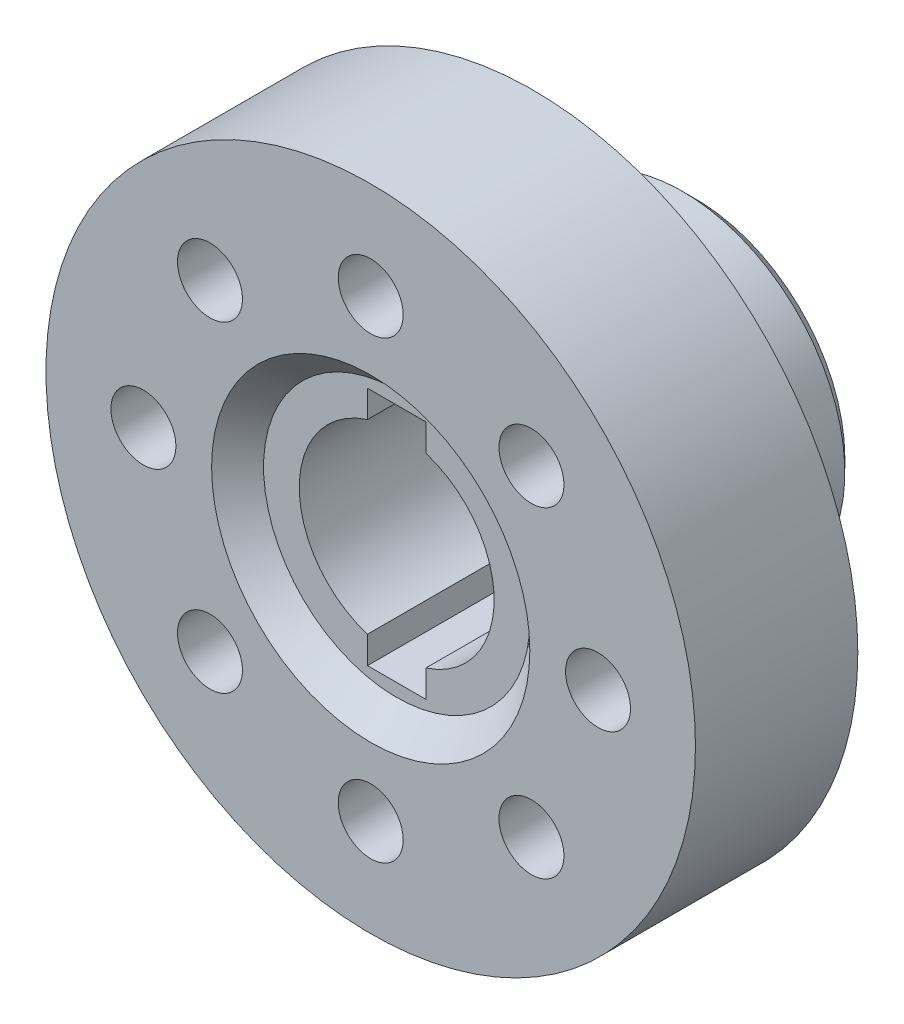
from build123d import *

# Parameters (mm, degrees)
SKETCH1_R                                = 50
BOSS_EXTRUDE1_DEPTH                      = 25
CBORE_FOR_M10_HEX_HEAD_BOLT1_D           = 10
CBORE_FOR_M10_HEX_HEAD_BOLT1_CBORE_D     = 20
CBORE_FOR_M10_HEX_HEAD_BOLT1_CBORE_DEPTH = 12.5
SKETCH5_R                                = 25
BOSS_EXTRUDE2_DEPTH                      = 25
CHAMFER1_SIZE                            = 2
CUT_EXTRUDE1_DEPTH                       = 87.602540436
SKETCH9_R                                = 24.5
CUT_EXTRUDE2_DEPTH                       = 4
CHAMFER2_SIZE                            = 4
CHAMFER3_SIZE                            = 2


# Some blends are built 0.0001 mm under size
with BuildPart() as part:
    # Sketch1 → Boss-Extrude1 (new body)
    with BuildSketch(Plane.XY):
        Circle(SKETCH1_R)
    extrude(amount=-BOSS_EXTRUDE1_DEPTH)

    # CBORE for M10 Hex Head Bolt1 (through all)
    with Locations(Plane(origin=(0, 0, -25), x_dir=(-1, 0, 0), z_dir=(0, 0, -1))):
        with Locations((-24.748737342, 24.748737342), (0, 35), (24.748737342, 24.748737342), (35, 0), (24.748737342, -24.748737342), (0, -35), (-24.748737342, -24.748737342), (-35, 0)):
            CounterBoreHole(CBORE_FOR_M10_HEX_HEAD_BOLT1_D / 2, CBORE_FOR_M10_HEX_HEAD_BOLT1_CBORE_D / 2, CBORE_FOR_M10_HEX_HEAD_BOLT1_CBORE_DEPTH)

    # Sketch5 → Boss-Extrude2 (add)
    with BuildSketch(Plane(origin=(0, 0, -25), x_dir=(-1, 0, 0), z_dir=(0, 0, -1))):
        with Locations(Location((0, 0, 0), (0, 0, 180))):
            Circle(SKETCH5_R)
    extrude(amount=BOSS_EXTRUDE2_DEPTH)

    # Chamfer1
    # the kernel refuses this chamfer: 2 mm, written as the material it takes off along each edge
    with BuildSketch(Plane(origin=(24.748737342, 24.748737342, -25), x_dir=(-1, 0, 0), z_dir=(0, -1, 0))) as chamfer1_piece_1_section:
        Polygon((10 + CHAMFER1_SIZE, 0), (10, -CHAMFER1_SIZE), (10, 0), align=None)
    chamfer1_piece_1 = revolve(axis=Axis((24.748737342, 24.748737342, -25), (0, 0, -1)), revolution_arc=315.000000416, mode=Mode.PRIVATE)
    chamfer1_piece_1 = chamfer1_piece_1 - Plane(origin=(0, 0, -24.034020629), x_dir=(1, 0, 0), z_dir=(0, 0, 1)) * Cylinder(25, 48, mode=Mode.PRIVATE)
    add(chamfer1_piece_1, mode=Mode.SUBTRACT)
    with BuildSketch(Plane(origin=(35, 0, -25), x_dir=(-1, 0, 0), z_dir=(0, -1, 0))) as chamfer1_piece_2_section:
        Polygon((10 + CHAMFER1_SIZE, 0), (10, -CHAMFER1_SIZE), (10, 0), align=None)
    chamfer1_piece_2 = revolve(axis=Axis((35, 0, -25), (0, 0, -1)), mode=Mode.PRIVATE)
    chamfer1_piece_2 = chamfer1_piece_2 - Plane(origin=(0, 0, -24.035090303), x_dir=(1, 0, 0), z_dir=(0, 0, 1)) * Cylinder(25, 48, mode=Mode.PRIVATE)
    add(chamfer1_piece_2, mode=Mode.SUBTRACT)
    with BuildSketch(Plane(origin=(24.748737342, -24.748737342, -25), x_dir=(-1, 0, 0), z_dir=(0, -1, 0))) as chamfer1_piece_3_section:
        Polygon((10 + CHAMFER1_SIZE, 0), (10, -CHAMFER1_SIZE), (10, 0), align=None)
    chamfer1_piece_3 = revolve(axis=Axis((24.748737342, -24.748737342, -25), (0, 0, -1)), revolution_arc=44.999998935, mode=Mode.PRIVATE)
    chamfer1_piece_3 = chamfer1_piece_3 - Plane(origin=(0, 0, -24.295051561), x_dir=(1, 0, 0), z_dir=(0, 0, 1)) * Cylinder(25, 48, mode=Mode.PRIVATE)
    add(chamfer1_piece_3, mode=Mode.SUBTRACT)
    with BuildSketch(Plane(origin=(0, -35, -25), x_dir=(-1, 0, 0), z_dir=(0, -1, 0))) as chamfer1_piece_4_section:
        Polygon((10 + CHAMFER1_SIZE, 0), (10, -CHAMFER1_SIZE), (10, 0), align=None)
    chamfer1_piece_4 = revolve(axis=Axis((0, -35, -25), (0, 0, -1)), revolution_arc=90.00000015, mode=Mode.PRIVATE)
    chamfer1_piece_4 = chamfer1_piece_4 - Plane(origin=(0, 0, -24.021368021), x_dir=(1, 0, 0), z_dir=(0, 0, 1)) * Cylinder(25, 48, mode=Mode.PRIVATE)
    add(chamfer1_piece_4, mode=Mode.SUBTRACT)
    with BuildSketch(Plane(origin=(-24.748737342, -24.748737342, -25), x_dir=(0.7071067835812739, 0.7071067787918212, 0), z_dir=(-0.7071067787918212, 0.7071067835812739, 0))) as chamfer1_piece_5_section:
        Polygon((10 + CHAMFER1_SIZE, 0), (10, -CHAMFER1_SIZE), (10, 0), align=None)
    chamfer1_piece_5 = revolve(axis=Axis((-24.748737342, -24.748737342, -25), (0, 0, -1)), revolution_arc=224.999999806, mode=Mode.PRIVATE)
    chamfer1_piece_5 = chamfer1_piece_5 - Plane(origin=(0, 0, -24.030194299), x_dir=(1, 0, 0), z_dir=(0, 0, 1)) * Cylinder(25, 49, mode=Mode.PRIVATE)
    add(chamfer1_piece_5, mode=Mode.SUBTRACT)
    with BuildSketch(Plane(origin=(-35, 0, -25), x_dir=(-1, 0, 0), z_dir=(0, -1, 0))) as chamfer1_piece_6_section:
        Polygon((10 + CHAMFER1_SIZE, 0), (10, -CHAMFER1_SIZE), (10, 0), align=None)
    chamfer1_piece_6 = revolve(axis=Axis((-35, 0, -25), (0, 0, -1)), revolution_arc=180.000000155, mode=Mode.PRIVATE)
    chamfer1_piece_6 = chamfer1_piece_6 - Plane(origin=(0, 0, -24.027851375), x_dir=(1, 0, 0), z_dir=(0, 0, 1)) * Cylinder(25, 48, mode=Mode.PRIVATE)
    add(chamfer1_piece_6, mode=Mode.SUBTRACT)
    with BuildSketch(Plane(origin=(-24.748737342, 24.748737342, -25), x_dir=(-1, 0, 0), z_dir=(0, -1, 0))) as chamfer1_piece_7_section:
        Polygon((10 + CHAMFER1_SIZE, 0), (10, -CHAMFER1_SIZE), (10, 0), align=None)
    chamfer1_piece_7 = revolve(axis=Axis((-24.748737342, 24.748737342, -25), (0, 0, -1)), revolution_arc=225.000000551, mode=Mode.PRIVATE)
    chamfer1_piece_7 = chamfer1_piece_7 - Plane(origin=(0, 0, -24.030194347), x_dir=(1, 0, 0), z_dir=(0, 0, 1)) * Cylinder(25, 48, mode=Mode.PRIVATE)
    add(chamfer1_piece_7, mode=Mode.SUBTRACT)
    with BuildSketch(Plane(origin=(0, 35, -25), x_dir=(-1, 0, 0), z_dir=(0, -1, 0))) as chamfer1_piece_8_section:
        Polygon((10 + CHAMFER1_SIZE, 0), (10, -CHAMFER1_SIZE), (10, 0), align=None)
    chamfer1_piece_8 = revolve(axis=Axis((0, 35, -25), (0, 0, -1)), revolution_arc=269.999999979, mode=Mode.PRIVATE)
    chamfer1_piece_8 = chamfer1_piece_8 - Plane(origin=(0, 0, -24.032221046), x_dir=(1, 0, 0), z_dir=(0, 0, 1)) * Cylinder(25, 48, mode=Mode.PRIVATE)
    add(chamfer1_piece_8, mode=Mode.SUBTRACT)
    with BuildSketch(Plane(origin=(0, 35, -25), x_dir=(3.7419774552245994e-10, -1.0, 0), z_dir=(1.0, 3.7419774552245994e-10, 0))) as chamfer1_piece_9_section:
        Polygon((10 + CHAMFER1_SIZE, 0), (10, -CHAMFER1_SIZE), (10, 0), align=None)
    chamfer1_piece_9 = revolve(axis=Axis((0, 35, -25), (0, 0, -1)), revolution_arc=90.000000021, mode=Mode.PRIVATE)
    chamfer1_piece_9 = chamfer1_piece_9 - Plane(origin=(0, 0, -24.021368016), x_dir=(1, 0, 0), z_dir=(0, 0, 1)) * Cylinder(25, 48, mode=Mode.PRIVATE)
    add(chamfer1_piece_9, mode=Mode.SUBTRACT)
    with BuildSketch(Plane(origin=(-24.748737342, 24.748737342, -25), x_dir=(0.7071067743839492, -0.7071067879891458, 0), z_dir=(0.7071067879891458, 0.7071067743839492, 0))) as chamfer1_piece_10_section:
        Polygon((10 + CHAMFER1_SIZE, 0), (10, -CHAMFER1_SIZE), (10, 0), align=None)
    chamfer1_piece_10 = revolve(axis=Axis((-24.748737342, 24.748737342, -25), (0, 0, -1)), revolution_arc=134.999999449, mode=Mode.PRIVATE)
    chamfer1_piece_10 = chamfer1_piece_10 - Plane(origin=(0, 0, -24.025029467), x_dir=(1, 0, 0), z_dir=(0, 0, 1)) * Cylinder(25, 48, mode=Mode.PRIVATE)
    add(chamfer1_piece_10, mode=Mode.SUBTRACT)
    with BuildSketch(Plane(origin=(-35, 0, -25), x_dir=(1.0, -2.710294976997066e-09, 0), z_dir=(2.710294976997066e-09, 1.0, 0))) as chamfer1_piece_11_section:
        Polygon((10 + CHAMFER1_SIZE, 0), (10, -CHAMFER1_SIZE), (10, 0), align=None)
    chamfer1_piece_11 = revolve(axis=Axis((-35, 0, -25), (0, 0, -1)), revolution_arc=179.999999845, mode=Mode.PRIVATE)
    chamfer1_piece_11 = chamfer1_piece_11 - Plane(origin=(0, 0, -24.027851322), x_dir=(1, 0, 0), z_dir=(0, 0, 1)) * Cylinder(25, 48, mode=Mode.PRIVATE)
    add(chamfer1_piece_11, mode=Mode.SUBTRACT)
    with BuildSketch(Plane(origin=(-24.748737342, -24.748737342, -25), x_dir=(-1, 0, 0), z_dir=(0, -1, 0))) as chamfer1_piece_12_section:
        Polygon((10 + CHAMFER1_SIZE, 0), (10, -CHAMFER1_SIZE), (10, 0), align=None)
    chamfer1_piece_12 = revolve(axis=Axis((-24.748737342, -24.748737342, -25), (0, 0, -1)), revolution_arc=135.000000194, mode=Mode.PRIVATE)
    chamfer1_piece_12 = chamfer1_piece_12 - Plane(origin=(0, 0, -24.025029447), x_dir=(1, 0, 0), z_dir=(0, 0, 1)) * Cylinder(25, 48, mode=Mode.PRIVATE)
    add(chamfer1_piece_12, mode=Mode.SUBTRACT)
    with BuildSketch(Plane(origin=(0, -35, -25), x_dir=(2.620144484540633e-09, 1.0, 0), z_dir=(-1.0, 2.620144484540633e-09, 0))) as chamfer1_piece_13_section:
        Polygon((10 + CHAMFER1_SIZE, 0), (10, -CHAMFER1_SIZE), (10, 0), align=None)
    chamfer1_piece_13 = revolve(axis=Axis((0, -35, -25), (0, 0, -1)), revolution_arc=269.99999985, mode=Mode.PRIVATE)
    chamfer1_piece_13 = chamfer1_piece_13 - Plane(origin=(0, 0, -24.032221078), x_dir=(1, 0, 0), z_dir=(0, 0, 1)) * Cylinder(25, 48, mode=Mode.PRIVATE)
    add(chamfer1_piece_13, mode=Mode.SUBTRACT)
    with BuildSketch(Plane(origin=(24.748737342, -24.748737342, -25), x_dir=(-0.707106794329391, 0.7071067680437038, 0), z_dir=(-0.7071067680437038, -0.707106794329391, 0))) as chamfer1_piece_14_section:
        Polygon((10 + CHAMFER1_SIZE, 0), (10, -CHAMFER1_SIZE), (10, 0), align=None)
    chamfer1_piece_14 = revolve(axis=Axis((24.748737342, -24.748737342, -25), (0, 0, -1)), revolution_arc=315.000001065, mode=Mode.PRIVATE)
    chamfer1_piece_14 = chamfer1_piece_14 - Plane(origin=(0, 0, -24.034020657), x_dir=(1, 0, 0), z_dir=(0, 0, 1)) * Cylinder(25, 49, mode=Mode.PRIVATE)
    add(chamfer1_piece_14, mode=Mode.SUBTRACT)
    with BuildSketch(Plane(origin=(24.748737342, 24.748737342, -25), x_dir=(-0.7071067863158467, -0.7071067760572484, 0), z_dir=(0.7071067760572484, -0.7071067863158467, 0))) as chamfer1_piece_15_section:
        Polygon((10 + CHAMFER1_SIZE, 0), (10, -CHAMFER1_SIZE), (10, 0), align=None)
    chamfer1_piece_15 = revolve(axis=Axis((24.748737342, 24.748737342, -25), (0, 0, -1)), revolution_arc=44.999999584, mode=Mode.PRIVATE)
    chamfer1_piece_15 = chamfer1_piece_15 - Plane(origin=(0, 0, -24.295051641), x_dir=(1, 0, 0), z_dir=(0, 0, 1)) * Cylinder(25, 48, mode=Mode.PRIVATE)
    add(chamfer1_piece_15, mode=Mode.SUBTRACT)

    # Sketch8 → Cut-Extrude1 (cut, through all)
    with BuildSketch(Plane.XY):
        with BuildLine():
            Line((-4.5, 14.309088021), (-4.5, 18.5))
            Line((-4.5, 18.5), (4.5, 18.5))
            Line((4.5, 18.5), (4.5, 14.309088021))
            ThreePointArc((4.5, 14.309088021), (15, 0), (4.5, -14.309088021))
            Line((4.5, -14.309088021), (4.5, -18.5))
            Line((4.5, -18.5), (-4.5, -18.5))
            Line((-4.5, -18.5), (-4.5, -14.309088021))
            ThreePointArc((-4.5, -14.309088021), (-15, 0), (-4.5, 14.309088021))
        make_face()
    extrude(amount=-CUT_EXTRUDE1_DEPTH, mode=Mode.SUBTRACT)

    # Sketch9 → Cut-Extrude2 (cut)
    with BuildSketch(Plane.XY):
        Circle(SKETCH9_R)
    extrude(amount=-CUT_EXTRUDE2_DEPTH, mode=Mode.SUBTRACT)

    # Chamfer2
    chamfer2_edges = [part.edges().sort_by_distance(p)[0] for p in [
        (-24.5, 0, -4),
    ]]
    chamfer(chamfer2_edges, length=CHAMFER2_SIZE - 0.0001)  # a hair under: the kernel refuses the full size

    # Chamfer3
    chamfer3_edges = [part.edges().sort_by_distance(p)[0] for p in [
        (-25, 0, -50),
    ]]
    chamfer(chamfer3_edges, length=CHAMFER3_SIZE)


solid = part.part
